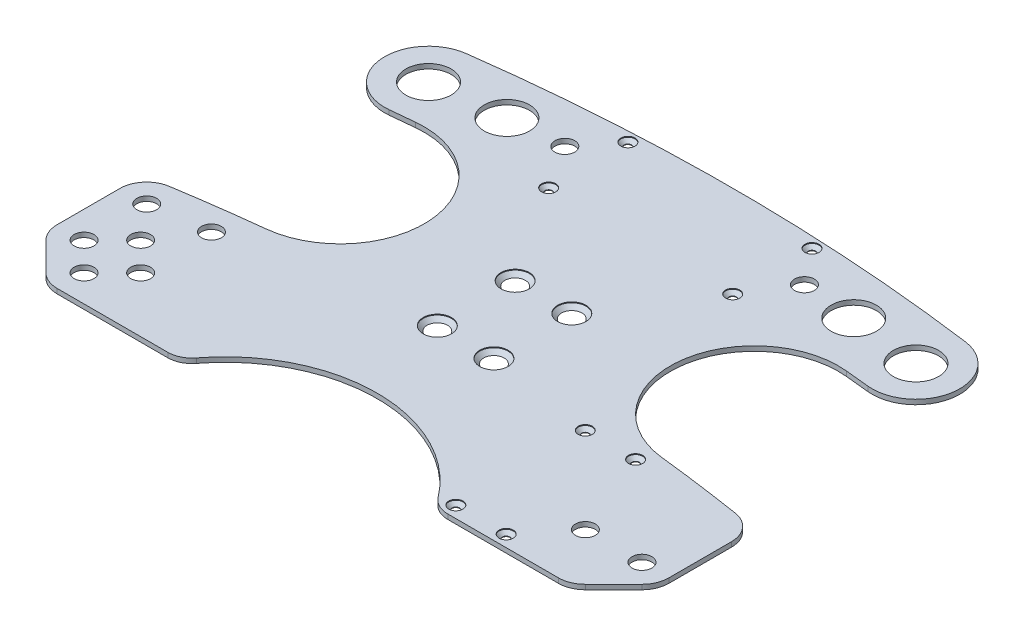
from build123d import *

# Parameters (mm, degrees)
SKETCH1_R                                      = 2.5
BOSS_EXTRUDE1_DEPTH                            = 1.69
CUT_EXTRUDE1_REACH                             = 155.062
SKETCH2_R                                      = 3.5
SKETCH2_R_2                                    = 8
CUT_EXTRUDE2_REACH                             = 155.062
SKETCH3_R                                      = 1.3
CSK_FOR_M5_FLAT_HEAD_MACHINE_SCREW1_AT_2_COUNT = 2
CSK_FOR_M5_FLAT_HEAD_MACHINE_SCREW1_AT_2_PITCH = 20
CSK_FOR_M5_FLAT_HEAD_MACHINE_SCREW1_AT_3_COUNT = 2
CSK_FOR_M5_FLAT_HEAD_MACHINE_SCREW1_AT_3_PITCH = 34.003676272
CSK_FOR_M5_FLAT_HEAD_MACHINE_SCREW1_AT_4_COUNT = 2
CSK_FOR_M5_FLAT_HEAD_MACHINE_SCREW1_AT_4_PITCH = 27.5
CUT_EXTRUDE3_REACH                             = 136.744
SKETCH8_R                                      = 1.3
CSK_FOR_M2_5_FLAT_HEAD_MACHINE_SCREW1_AT_COUNT = 2
CSK_FOR_M2_5_FLAT_HEAD_MACHINE_SCREW1_AT_PITCH = 17.78
CSK_FOR_M2_5_FLAT_HEAD_MACHINE_SCREW_2_COUNT   = 2
CSK_FOR_M2_5_FLAT_HEAD_MACHINE_SCREW_2_PITCH   = 49.055548106
CSK_FOR_M2_5_FLAT_HEAD_MACHINE_SCREW_3_COUNT   = 2
CSK_FOR_M2_5_FLAT_HEAD_MACHINE_SCREW_3_PITCH   = 45.72
CSK_FOR_M2_5_FLAT_HEAD_MACHINE_SCREW_4_COUNT   = 2
CSK_FOR_M2_5_FLAT_HEAD_MACHINE_SCREW_4_PITCH   = 96.995284539
CSK_FOR_M2_5_FLAT_HEAD_MACHINE_SCREW_5_COUNT   = 2
CSK_FOR_M2_5_FLAT_HEAD_MACHINE_SCREW_5_PITCH   = 69.509163048
CSK_FOR_M2_5_FLAT_HEAD_MACHINE_SCREW_6_COUNT   = 2
CSK_FOR_M2_5_FLAT_HEAD_MACHINE_SCREW_6_PITCH   = 125.17053696
CSK_FOR_M2_5_FLAT_HEAD_MACHINE_SCREW_7_COUNT   = 2
CSK_FOR_M2_5_FLAT_HEAD_MACHINE_SCREW_7_PITCH   = 105.3143003
FILLET1_R                                      = 8.5


with BuildPart() as part:
    # Sketch1 → Boss-Extrude1 (new body)
    with BuildSketch(Plane(origin=(0, 0, 0), x_dir=(1, 0, 0), z_dir=(0, 1, 0))):
        with BuildLine():
            Line((-73.314391493, -95), (73.314391493, -95))
            ThreePointArc((73.314391493, -95), (120, 0), (73.314391493, 95))
            Line((73.314391493, 95), (-73.314391493, 95))
            ThreePointArc((-73.314391493, 95), (-120, 0), (-73.314391493, -95))
        make_face()
        with Locations((-10, 13.75)):
            Circle(SKETCH1_R, mode=Mode.SUBTRACT)
        with Locations((-10, -13.75)):
            Circle(SKETCH1_R, mode=Mode.SUBTRACT)
        with Locations((10, -13.75)):
            Circle(SKETCH1_R, mode=Mode.SUBTRACT)
        with Locations((10, 13.75)):
            Circle(SKETCH1_R, mode=Mode.SUBTRACT)
    extrude(amount=BOSS_EXTRUDE1_DEPTH)

    # Sketch2 → Cut-Extrude1 (cut, up to next)
    with BuildSketch(Plane(origin=(0, 1.69, 0), x_dir=(1, 0, 0), z_dir=(0, 1, 0)), mode=Mode.PRIVATE) as cut_extrude1_sk1:
        with Locations((-88.540600769, -40)):
            Circle(SKETCH2_R)
    cut_extrude1_tool1 = extrude(cut_extrude1_sk1.sketch, amount=-CUT_EXTRUDE1_REACH, mode=Mode.PRIVATE) & part.part
    # Sketch2 → Cut-Extrude1 (cut, up to next)
    with BuildSketch(Plane(origin=(0, 1.69, 0), x_dir=(1, 0, 0), z_dir=(0, 1, 0)), mode=Mode.PRIVATE) as cut_extrude1_sk2:
        with Locations((-78.540600769, -50)):
            Circle(SKETCH2_R)
    cut_extrude1_tool2 = extrude(cut_extrude1_sk2.sketch, amount=-CUT_EXTRUDE1_REACH, mode=Mode.PRIVATE) & part.part
    # Sketch2 → Cut-Extrude1 (cut, up to next)
    with BuildSketch(Plane(origin=(0, 1.69, 0), x_dir=(1, 0, 0), z_dir=(0, 1, 0)), mode=Mode.PRIVATE) as cut_extrude1_sk3:
        with Locations((-88.540600769, -60)):
            Circle(SKETCH2_R)
    cut_extrude1_tool3 = extrude(cut_extrude1_sk3.sketch, amount=-CUT_EXTRUDE1_REACH, mode=Mode.PRIVATE) & part.part
    # Sketch2 → Cut-Extrude1 (cut, up to next)
    with BuildSketch(Plane(origin=(0, 1.69, 0), x_dir=(1, 0, 0), z_dir=(0, 1, 0)), mode=Mode.PRIVATE) as cut_extrude1_sk4:
        with Locations((-98.540600769, -50)):
            Circle(SKETCH2_R)
    cut_extrude1_tool4 = extrude(cut_extrude1_sk4.sketch, amount=-CUT_EXTRUDE1_REACH, mode=Mode.PRIVATE) & part.part
    # Sketch2 → Cut-Extrude1 (cut, up to next)
    with BuildSketch(Plane(origin=(0, 1.69, 0), x_dir=(1, 0, 0), z_dir=(0, 1, 0)), mode=Mode.PRIVATE) as cut_extrude1_sk5:
        with Locations((78.540600769, -50)):
            Circle(SKETCH2_R)
    cut_extrude1_tool5 = extrude(cut_extrude1_sk5.sketch, amount=-CUT_EXTRUDE1_REACH, mode=Mode.PRIVATE) & part.part
    # Sketch2 → Cut-Extrude1 (cut, up to next)
    with BuildSketch(Plane(origin=(0, 1.69, 0), x_dir=(1, 0, 0), z_dir=(0, 1, 0)), mode=Mode.PRIVATE) as cut_extrude1_sk6:
        with Locations((98.540600769, -50)):
            Circle(SKETCH2_R)
    cut_extrude1_tool6 = extrude(cut_extrude1_sk6.sketch, amount=-CUT_EXTRUDE1_REACH, mode=Mode.PRIVATE) & part.part
    # Sketch2 → Cut-Extrude1 (cut, up to next)
    with BuildSketch(Plane(origin=(0, 1.69, 0), x_dir=(1, 0, 0), z_dir=(0, 1, 0)), mode=Mode.PRIVATE) as cut_extrude1_sk7:
        with Locations((-98.540600769, -27.862546721)):
            Circle(SKETCH2_R)
    cut_extrude1_tool7 = extrude(cut_extrude1_sk7.sketch, amount=-CUT_EXTRUDE1_REACH, mode=Mode.PRIVATE) & part.part
    # Sketch2 → Cut-Extrude1 (cut, up to next)
    with BuildSketch(Plane(origin=(0, 1.69, 0), x_dir=(1, 0, 0), z_dir=(0, 1, 0)), mode=Mode.PRIVATE) as cut_extrude1_sk8:
        with Locations((-78.540600769, -25)):
            Circle(SKETCH2_R)
    cut_extrude1_tool8 = extrude(cut_extrude1_sk8.sketch, amount=-CUT_EXTRUDE1_REACH, mode=Mode.PRIVATE) & part.part
    # Sketch2 → Cut-Extrude1 (cut, up to next)
    with BuildSketch(Plane(origin=(0, 1.69, 0), x_dir=(1, 0, 0), z_dir=(0, 1, 0)), mode=Mode.PRIVATE) as cut_extrude1_sk9:
        with Locations((-86.094520408, 59.228232759)):
            Circle(SKETCH2_R_2)
    cut_extrude1_tool9 = extrude(cut_extrude1_sk9.sketch, amount=-CUT_EXTRUDE1_REACH, mode=Mode.PRIVATE) & part.part
    # Sketch2 → Cut-Extrude1 (cut, up to next)
    with BuildSketch(Plane(origin=(0, 1.69, 0), x_dir=(1, 0, 0), z_dir=(0, 1, 0)), mode=Mode.PRIVATE) as cut_extrude1_sk10:
        with Locations((-61.259580586, 62.084312054)):
            Circle(SKETCH2_R_2)
    cut_extrude1_tool10 = extrude(cut_extrude1_sk10.sketch, amount=-CUT_EXTRUDE1_REACH, mode=Mode.PRIVATE) & part.part
    # Sketch2 → Cut-Extrude1 (cut, up to next)
    with BuildSketch(Plane(origin=(0, 1.69, 0), x_dir=(1, 0, 0), z_dir=(0, 1, 0)), mode=Mode.PRIVATE) as cut_extrude1_sk11:
        with Locations((61.259580586, 62.084312054)):
            Circle(SKETCH2_R_2)
    cut_extrude1_tool11 = extrude(cut_extrude1_sk11.sketch, amount=-CUT_EXTRUDE1_REACH, mode=Mode.PRIVATE) & part.part
    # Sketch2 → Cut-Extrude1 (cut, up to next)
    with BuildSketch(Plane(origin=(0, 1.69, 0), x_dir=(1, 0, 0), z_dir=(0, 1, 0)), mode=Mode.PRIVATE) as cut_extrude1_sk12:
        with Locations((86.094520408, 59.228232759)):
            Circle(SKETCH2_R_2)
    cut_extrude1_tool12 = extrude(cut_extrude1_sk12.sketch, amount=-CUT_EXTRUDE1_REACH, mode=Mode.PRIVATE) & part.part
    # Sketch2 → Cut-Extrude1 (cut, up to next)
    with BuildSketch(Plane(origin=(0, 1.69, 0), x_dir=(1, 0, 0), z_dir=(0, 1, 0)), mode=Mode.PRIVATE) as cut_extrude1_sk13:
        with Locations((-42.320942156, 63.610082158)):
            Circle(SKETCH2_R)
    cut_extrude1_tool13 = extrude(cut_extrude1_sk13.sketch, amount=-CUT_EXTRUDE1_REACH, mode=Mode.PRIVATE) & part.part
    # Sketch2 → Cut-Extrude1 (cut, up to next)
    with BuildSketch(Plane(origin=(0, 1.69, 0), x_dir=(1, 0, 0), z_dir=(0, 1, 0)), mode=Mode.PRIVATE) as cut_extrude1_sk14:
        with Locations((42.320942156, 63.610082158)):
            Circle(SKETCH2_R)
    cut_extrude1_tool14 = extrude(cut_extrude1_sk14.sketch, amount=-CUT_EXTRUDE1_REACH, mode=Mode.PRIVATE) & part.part
    add(cut_extrude1_tool1.solids().sort_by_distance((-88.540601, 1.69, 40))[0], mode=Mode.SUBTRACT)
    add(cut_extrude1_tool2.solids().sort_by_distance((-78.540601, 1.69, 50))[0], mode=Mode.SUBTRACT)
    add(cut_extrude1_tool3.solids().sort_by_distance((-88.540601, 1.69, 60))[0], mode=Mode.SUBTRACT)
    add(cut_extrude1_tool4.solids().sort_by_distance((-98.540601, 1.69, 50))[0], mode=Mode.SUBTRACT)
    add(cut_extrude1_tool5.solids().sort_by_distance((78.540601, 1.69, 50))[0], mode=Mode.SUBTRACT)
    add(cut_extrude1_tool6.solids().sort_by_distance((98.540601, 1.69, 50))[0], mode=Mode.SUBTRACT)
    add(cut_extrude1_tool7.solids().sort_by_distance((-98.540601, 1.69, 27.862547))[0], mode=Mode.SUBTRACT)
    add(cut_extrude1_tool8.solids().sort_by_distance((-78.540601, 1.69, 25))[0], mode=Mode.SUBTRACT)
    add(cut_extrude1_tool9.solids().sort_by_distance((-86.09452, 1.69, -59.228233))[0], mode=Mode.SUBTRACT)
    add(cut_extrude1_tool10.solids().sort_by_distance((-61.259581, 1.69, -62.084312))[0], mode=Mode.SUBTRACT)
    add(cut_extrude1_tool11.solids().sort_by_distance((61.259581, 1.69, -62.084312))[0], mode=Mode.SUBTRACT)
    add(cut_extrude1_tool12.solids().sort_by_distance((86.09452, 1.69, -59.228233))[0], mode=Mode.SUBTRACT)
    add(cut_extrude1_tool13.solids().sort_by_distance((-42.320942, 1.69, -63.610082))[0], mode=Mode.SUBTRACT)
    add(cut_extrude1_tool14.solids().sort_by_distance((42.320942, 1.69, -63.610082))[0], mode=Mode.SUBTRACT)

    # Sketch3 → Cut-Extrude2 (cut, up to next)
    with BuildSketch(Plane(origin=(0, 1.69, 0), x_dir=(1, 0, 0), z_dir=(0, 1, 0)), mode=Mode.PRIVATE) as cut_extrude2_sk1:
        with BuildLine():
            Line((-76.10593, 44.650651173), (-84.550645906, 43.805313077))
            ThreePointArc((-84.550645906, 43.805313077), (-99.43666838, 51.339184178), (-98.864521038, 68.013281644))
            ThreePointArc((-98.864521038, 68.013281644), (-119.734623709, 7.976207444), (-107.012417185, -54.298642417))
            ThreePointArc((-107.012417185, -54.298642417), (-107.779979968, -52.209948422), (-108.040600769, -50))
            Line((-108.040600769, -50), (-108.040600769, -27.862546721))
            ThreePointArc((-108.040600769, -27.862546721), (-105.768300058, -21.697292226), (-100.038419088, -18.48136661))
            ThreePointArc((-100.038419088, -18.48136661), (-84.982869022, -16.26238104), (-69.878431834, -14.405108315))
            ThreePointArc((-69.878431834, -14.405108315), (-43.620166681, 18.220084314), (-76.10593, 44.650651173))
        make_face()
    cut_extrude2_tool1 = extrude(cut_extrude2_sk1.sketch, amount=-CUT_EXTRUDE2_REACH, mode=Mode.PRIVATE) & part.part
    # Sketch3 → Cut-Extrude2 (cut, up to next)
    with BuildSketch(Plane(origin=(0, 1.69, 0), x_dir=(1, 0, 0), z_dir=(0, 1, 0)), mode=Mode.PRIVATE) as cut_extrude2_sk2:
        with BuildLine():
            ThreePointArc((-98.864521038, 68.013281644), (-94.209951242, 72.433905115), (-88.163448021, 74.589532786))
            ThreePointArc((-88.163448021, 74.589532786), (0, 80.5), (88.163448021, 74.589532786))
            ThreePointArc((88.163448021, 74.589532786), (94.209951372, 72.433905035), (98.864521211, 68.013281392))
            ThreePointArc((98.864521211, 68.013281392), (87.140491393, 82.501725798), (73.314391493, 95))
            Line((73.314391493, 95), (-73.314391493, 95))
            ThreePointArc((-73.314391493, 95), (-87.140491288, 82.501725909), (-98.864521038, 68.013281644))
        make_face()
    cut_extrude2_tool2 = extrude(cut_extrude2_sk2.sketch, amount=-CUT_EXTRUDE2_REACH, mode=Mode.PRIVATE) & part.part
    # Sketch3 → Cut-Extrude2 (cut, up to next)
    with BuildSketch(Plane(origin=(0, 1.69, 0), x_dir=(1, 0, 0), z_dir=(0, 1, 0)), mode=Mode.PRIVATE) as cut_extrude2_sk3:
        with BuildLine():
            ThreePointArc((-105.258115191, -56.717514421), (-106.230963456, -55.57748346), (-107.012417185, -54.298642417))
            ThreePointArc((-107.012417185, -54.298642417), (-92.431540122, -76.527187265), (-73.314391493, -95))
            Line((-73.314391493, -95), (73.314391493, -95))
            ThreePointArc((73.314391493, -95), (92.431540347, -76.527186994), (107.012417504, -54.298641787))
            ThreePointArc((107.012417504, -54.298641787), (106.230963664, -55.577483174), (105.258115191, -56.717514421))
            Line((105.258115191, -56.717514421), (95.258115191, -66.717514421))
            ThreePointArc((95.258115191, -66.717514421), (92.176093377, -68.776855559), (88.540600769, -69.5))
            Line((88.540600769, -69.5), (45.040600769, -69.5))
            ThreePointArc((45.040600769, -69.5), (0, -45), (-45.040600769, -69.5))
            Line((-45.040600769, -69.5), (-88.540600769, -69.5))
            ThreePointArc((-88.540600769, -69.5), (-92.176093377, -68.776855559), (-95.258115191, -66.717514421))
            Line((-95.258115191, -66.717514421), (-105.258115191, -56.717514421))
        make_face()
    cut_extrude2_tool3 = extrude(cut_extrude2_sk3.sketch, amount=-CUT_EXTRUDE2_REACH, mode=Mode.PRIVATE) & part.part
    # Sketch3 → Cut-Extrude2 (cut, up to next)
    with BuildSketch(Plane(origin=(0, 1.69, 0), x_dir=(1, 0, 0), z_dir=(0, 1, 0)), mode=Mode.PRIVATE) as cut_extrude2_sk4:
        with BuildLine():
            ThreePointArc((69.878431958, -14.405108329), (84.982868522, -16.262380972), (100.038417968, -18.481366431))
            ThreePointArc((100.038417968, -18.481366431), (105.768299691, -21.697291795), (108.040600769, -27.862546721))
            Line((108.040600769, -27.862546721), (108.040600769, -50))
            ThreePointArc((108.040600769, -50), (107.77998005, -52.209948079), (107.012417504, -54.298641787))
            ThreePointArc((107.012417504, -54.298641787), (119.734623696, 7.976207644), (98.864521211, 68.013281392))
            ThreePointArc((98.864521211, 68.013281392), (99.436668302, 51.339184047), (84.550645906, 43.805313077))
            Line((84.550645906, 43.805313077), (76.10593, 44.650651173))
            ThreePointArc((76.10593, 44.650651173), (43.620166674, 18.220084252), (69.878431958, -14.405108329))
        make_face()
    cut_extrude2_tool4 = extrude(cut_extrude2_sk4.sketch, amount=-CUT_EXTRUDE2_REACH, mode=Mode.PRIVATE) & part.part
    # Sketch3 → Cut-Extrude2 (cut, up to next)
    with BuildSketch(Plane(origin=(0, 1.69, 0), x_dir=(1, 0, 0), z_dir=(0, 1, 0)), mode=Mode.PRIVATE) as cut_extrude2_sk5:
        with Locations((48.150600769, -19.64)):
            Circle(SKETCH3_R)
    cut_extrude2_tool5 = extrude(cut_extrude2_sk5.sketch, amount=-CUT_EXTRUDE2_REACH, mode=Mode.PRIVATE) & part.part
    # Sketch3 → Cut-Extrude2 (cut, up to next)
    with BuildSketch(Plane(origin=(0, 1.69, 0), x_dir=(1, 0, 0), z_dir=(0, 1, 0)), mode=Mode.PRIVATE) as cut_extrude2_sk6:
        with Locations((65.930600769, -19.64)):
            Circle(SKETCH3_R)
    cut_extrude2_tool6 = extrude(cut_extrude2_sk6.sketch, amount=-CUT_EXTRUDE2_REACH, mode=Mode.PRIVATE) & part.part
    # Sketch3 → Cut-Extrude2 (cut, up to next)
    with BuildSketch(Plane(origin=(0, 1.69, 0), x_dir=(1, 0, 0), z_dir=(0, 1, 0)), mode=Mode.PRIVATE) as cut_extrude2_sk7:
        with Locations((65.930600769, -65.36)):
            Circle(SKETCH3_R)
    cut_extrude2_tool7 = extrude(cut_extrude2_sk7.sketch, amount=-CUT_EXTRUDE2_REACH, mode=Mode.PRIVATE) & part.part
    # Sketch3 → Cut-Extrude2 (cut, up to next)
    with BuildSketch(Plane(origin=(0, 1.69, 0), x_dir=(1, 0, 0), z_dir=(0, 1, 0)), mode=Mode.PRIVATE) as cut_extrude2_sk8:
        with Locations((48.150600769, -65.36)):
            Circle(SKETCH3_R)
    cut_extrude2_tool8 = extrude(cut_extrude2_sk8.sketch, amount=-CUT_EXTRUDE2_REACH, mode=Mode.PRIVATE) & part.part
    add(cut_extrude2_tool1.solids().sort_by_distance((-86.043963, 1.69, -12.513289))[0], mode=Mode.SUBTRACT)
    add(cut_extrude2_tool2.solids().sort_by_distance((0, 1.69, -86.177495))[0], mode=Mode.SUBTRACT)
    add(cut_extrude2_tool3.solids().sort_by_distance((0, 1.69, 75.736765))[0], mode=Mode.SUBTRACT)
    add(cut_extrude2_tool4.solids().sort_by_distance((86.043963, 1.69, -12.513289))[0], mode=Mode.SUBTRACT)
    add(cut_extrude2_tool5.solids().sort_by_distance((48.150601, 1.69, 19.64))[0], mode=Mode.SUBTRACT)
    add(cut_extrude2_tool6.solids().sort_by_distance((65.930601, 1.69, 19.64))[0], mode=Mode.SUBTRACT)
    add(cut_extrude2_tool7.solids().sort_by_distance((65.930601, 1.69, 65.36))[0], mode=Mode.SUBTRACT)
    add(cut_extrude2_tool8.solids().sort_by_distance((48.150601, 1.69, 65.36))[0], mode=Mode.SUBTRACT)

    # Sketch5 → CSK for M5 Flat Head Machine Screw1 (revolve, cut)
    with BuildSketch(Plane(origin=(-10, 1.69, -13.75), x_dir=(0, 0, 1), z_dir=(1, 0, 0))):
        Polygon((0, 0), (0, 6.502151548), (2.5, 5), (2.5, 2.8), (5, 0.3), (5, 0), align=None)
    csk_for_m5_flat_head_machine_screw1 = revolve(axis=Axis((-10, 8.04, -13.75), (0, -1, 0)), mode=Mode.SUBTRACT)

    # CSK for M5 Flat Head Machine Screw1 at 2: CSK for M5 Flat Head Machine Screw1 ×2
    with Locations(*[(i * CSK_FOR_M5_FLAT_HEAD_MACHINE_SCREW1_AT_2_PITCH, 0, 0) for i in range(1, CSK_FOR_M5_FLAT_HEAD_MACHINE_SCREW1_AT_2_COUNT)]):
        add(csk_for_m5_flat_head_machine_screw1, mode=Mode.SUBTRACT)

    # CSK for M5 Flat Head Machine Screw1 at 3: CSK for M5 Flat Head Machine Screw1 ×2
    with Locations(*[Vector(0.5881716976750462, 0, 0.8087360843031886) * (i * CSK_FOR_M5_FLAT_HEAD_MACHINE_SCREW1_AT_3_PITCH) for i in range(1, CSK_FOR_M5_FLAT_HEAD_MACHINE_SCREW1_AT_3_COUNT)]):
        add(csk_for_m5_flat_head_machine_screw1, mode=Mode.SUBTRACT)

    # CSK for M5 Flat Head Machine Screw1 at 4: CSK for M5 Flat Head Machine Screw1 ×2
    with Locations(*[(0, 0, i * CSK_FOR_M5_FLAT_HEAD_MACHINE_SCREW1_AT_4_PITCH) for i in range(1, CSK_FOR_M5_FLAT_HEAD_MACHINE_SCREW1_AT_4_COUNT)]):
        add(csk_for_m5_flat_head_machine_screw1, mode=Mode.SUBTRACT)

    # Sketch8 → Cut-Extrude3 (cut, up to next)
    with BuildSketch(Plane.XZ, mode=Mode.PRIVATE) as cut_extrude3_sk1:
        with Locations((-32.5, -48.084312054)):
            Circle(SKETCH8_R)
    cut_extrude3_tool1 = extrude(cut_extrude3_sk1.sketch, amount=-CUT_EXTRUDE3_REACH, mode=Mode.PRIVATE) & part.part
    # Sketch8 → Cut-Extrude3 (cut, up to next)
    with BuildSketch(Plane.XZ, mode=Mode.PRIVATE) as cut_extrude3_sk2:
        with Locations((32.5, -48.084312054)):
            Circle(SKETCH8_R)
    cut_extrude3_tool2 = extrude(cut_extrude3_sk2.sketch, amount=-CUT_EXTRUDE3_REACH, mode=Mode.PRIVATE) & part.part
    # Sketch8 → Cut-Extrude3 (cut, up to next)
    with BuildSketch(Plane.XZ, mode=Mode.PRIVATE) as cut_extrude3_sk3:
        with Locations((32.5, -76.084312054)):
            Circle(SKETCH8_R)
    cut_extrude3_tool3 = extrude(cut_extrude3_sk3.sketch, amount=-CUT_EXTRUDE3_REACH, mode=Mode.PRIVATE) & part.part
    # Sketch8 → Cut-Extrude3 (cut, up to next)
    with BuildSketch(Plane.XZ, mode=Mode.PRIVATE) as cut_extrude3_sk4:
        with Locations((-32.5, -76.084312054)):
            Circle(SKETCH8_R)
    cut_extrude3_tool4 = extrude(cut_extrude3_sk4.sketch, amount=-CUT_EXTRUDE3_REACH, mode=Mode.PRIVATE) & part.part
    add(cut_extrude3_tool1.solids().sort_by_distance((-32.5, 0, -48.084312))[0], mode=Mode.SUBTRACT)
    add(cut_extrude3_tool2.solids().sort_by_distance((32.5, 0, -48.084312))[0], mode=Mode.SUBTRACT)
    add(cut_extrude3_tool3.solids().sort_by_distance((32.5, 0, -76.084312))[0], mode=Mode.SUBTRACT)
    add(cut_extrude3_tool4.solids().sort_by_distance((-32.5, 0, -76.084312))[0], mode=Mode.SUBTRACT)

    # Sketch7 → CSK for M2.5 Flat Head Machine Screw1 (revolve, cut)
    with BuildSketch(Plane(origin=(48.150600769, 1.69, 19.64), x_dir=(0, 0, 1), z_dir=(1, 0, 0))):
        Polygon((0, 0), (0, 5.751075774), (1.25, 5), (1.25, 1.55), (2.5, 0.3), (2.5, 0), align=None)
    csk_for_m2_5_flat_head_machine_screw1 = revolve(axis=Axis((48.150600769, 8.04, 19.64), (0, -1, 0)), mode=Mode.SUBTRACT)

    # CSK for M2.5 Flat Head Machine Screw1 at: CSK for M2.5 Flat Head Machine Screw1 ×2
    with Locations(*[(i * CSK_FOR_M2_5_FLAT_HEAD_MACHINE_SCREW1_AT_PITCH, 0, 0) for i in range(1, CSK_FOR_M2_5_FLAT_HEAD_MACHINE_SCREW1_AT_COUNT)]):
        add(csk_for_m2_5_flat_head_machine_screw1, mode=Mode.SUBTRACT)

    # CSK for M2.5 Flat Head Machine Screw 2: CSK for M2.5 Flat Head Machine Screw1 ×2
    with Locations(*[Vector(0.3624462611549487, 0, 0.9320046715412958) * (i * CSK_FOR_M2_5_FLAT_HEAD_MACHINE_SCREW_2_PITCH) for i in range(1, CSK_FOR_M2_5_FLAT_HEAD_MACHINE_SCREW_2_COUNT)]):
        add(csk_for_m2_5_flat_head_machine_screw1, mode=Mode.SUBTRACT)

    # CSK for M2.5 Flat Head Machine Screw 3: CSK for M2.5 Flat Head Machine Screw1 ×2
    with Locations(*[(0, 0, i * CSK_FOR_M2_5_FLAT_HEAD_MACHINE_SCREW_3_PITCH) for i in range(1, CSK_FOR_M2_5_FLAT_HEAD_MACHINE_SCREW_3_COUNT)]):
        add(csk_for_m2_5_flat_head_machine_screw1, mode=Mode.SUBTRACT)

    # CSK for M2.5 Flat Head Machine Screw 4: CSK for M2.5 Flat Head Machine Screw1 ×2
    with Locations(*[Vector(-0.1613542435992395, 0, -0.9868965538862304) * (i * CSK_FOR_M2_5_FLAT_HEAD_MACHINE_SCREW_4_PITCH) for i in range(1, CSK_FOR_M2_5_FLAT_HEAD_MACHINE_SCREW_4_COUNT)]):
        add(csk_for_m2_5_flat_head_machine_screw1, mode=Mode.SUBTRACT)

    # CSK for M2.5 Flat Head Machine Screw 5: CSK for M2.5 Flat Head Machine Screw1 ×2
    with Locations(*[Vector(-0.2251588147958565, 0, -0.9743220761738519) * (i * CSK_FOR_M2_5_FLAT_HEAD_MACHINE_SCREW_5_PITCH) for i in range(1, CSK_FOR_M2_5_FLAT_HEAD_MACHINE_SCREW_5_COUNT)]):
        add(csk_for_m2_5_flat_head_machine_screw1, mode=Mode.SUBTRACT)

    # CSK for M2.5 Flat Head Machine Screw 6: CSK for M2.5 Flat Head Machine Screw1 ×2
    with Locations(*[Vector(-0.6443257553128567, 0, -0.7647511497477573) * (i * CSK_FOR_M2_5_FLAT_HEAD_MACHINE_SCREW_6_PITCH) for i in range(1, CSK_FOR_M2_5_FLAT_HEAD_MACHINE_SCREW_6_COUNT)]):
        add(csk_for_m2_5_flat_head_machine_screw1, mode=Mode.SUBTRACT)

    # CSK for M2.5 Flat Head Machine Screw 7: CSK for M2.5 Flat Head Machine Screw1 ×2
    with Locations(*[Vector(-0.7658086369994986, 0, -0.6430685278389622) * (i * CSK_FOR_M2_5_FLAT_HEAD_MACHINE_SCREW_7_PITCH) for i in range(1, CSK_FOR_M2_5_FLAT_HEAD_MACHINE_SCREW_7_COUNT)]):
        add(csk_for_m2_5_flat_head_machine_screw1, mode=Mode.SUBTRACT)

    # Fillet1
    fillet1_edges = [part.edges().sort_by_distance(p)[0] for p in [
        (45.040600769, 0.845, 69.5),
        (-45.040600769, 0.845, 69.5),
    ]]
    fillet(fillet1_edges, radius=FILLET1_R)


solid = part.part
